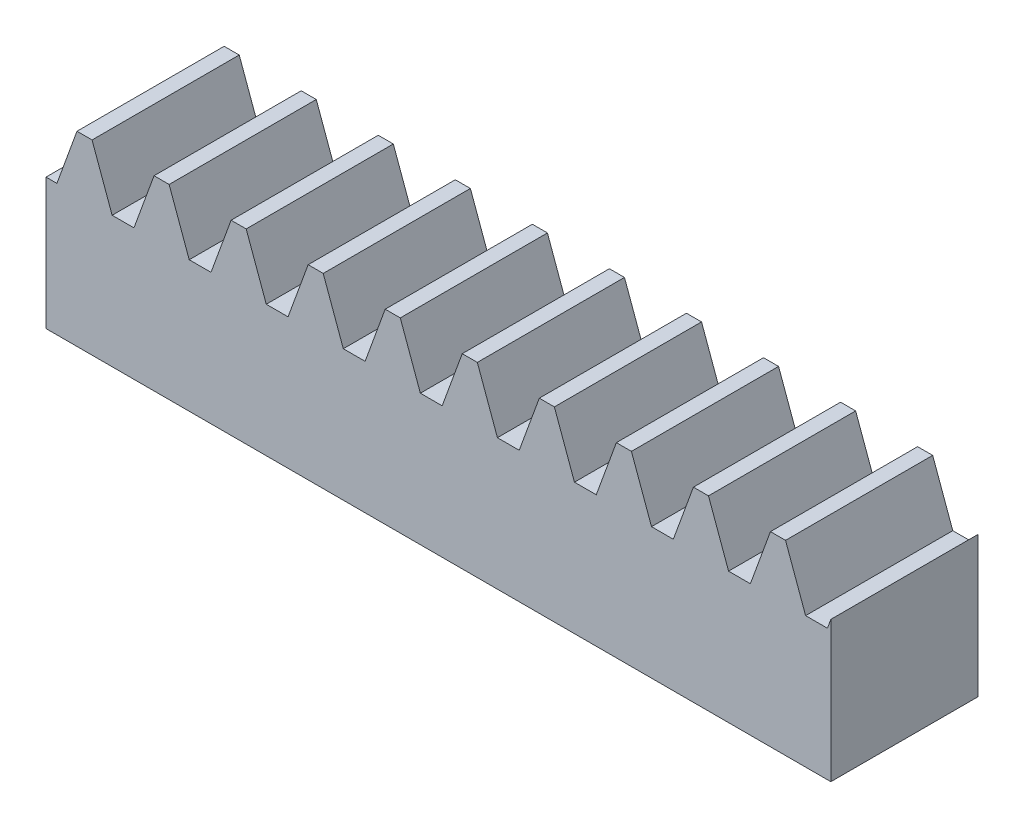
from build123d import *

# Parameters (mm, degrees)
BLANKSKE_W        = 16
BLANKSKE_H        = 3.8
BLANK_DEPTH       = 3
TOOTHCUTSIM_DEPTH = 17.716458955
TEETHCUTS_COUNT   = 12
TEETHCUTS_PITCH   = 1.570796325


with BuildPart() as part:
    # BlankSke → Blank (new body)
    with BuildSketch(Plane.XY):
        with Locations((8, 1.9)):
            Rectangle(BLANKSKE_W, BLANKSKE_H)
    extrude(amount=-BLANK_DEPTH)

    # TooCutSkeSim → ToothCutSim (cut, through all)
    with BuildSketch(Plane.XY):
        Polygon((0.222217685, 2.675), (-0.222217685, 2.675), (-0.640929042, 3.8254), (0.640929042, 3.8254), align=None)
    toothcutsim = extrude(amount=-TOOTHCUTSIM_DEPTH, mode=Mode.SUBTRACT)

    # TeethCuts: ToothCutSim ×12
    with Locations(*[(i * TEETHCUTS_PITCH, 0, 0) for i in range(1, TEETHCUTS_COUNT)]):
        add(toothcutsim, mode=Mode.SUBTRACT)


solid = part.part
